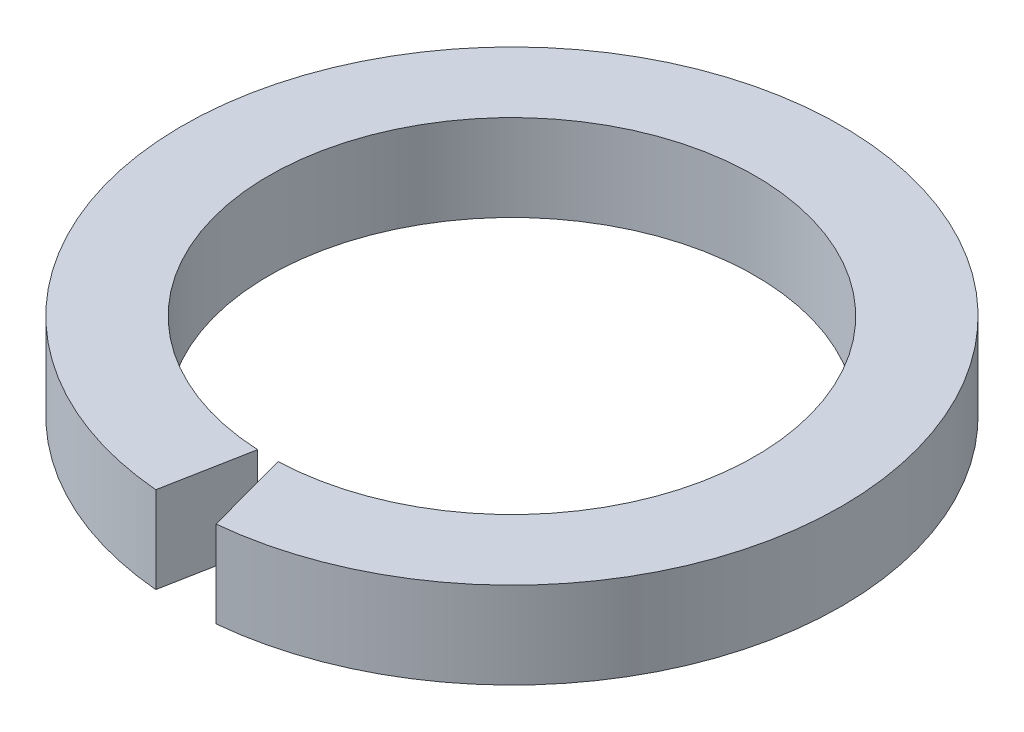
from build123d import *

# Parameters (mm, degrees)
SKETCH1_R               = 19.05
SKETCH1_R_2             = 14.05
BOSS_EXTRUDE1_DEPTH     = 5
CUT_EXTRUDE2_DEPTH      = 15
CUT_EXTRUDE2_DEPTH_BACK = 12


with BuildPart() as part:
    # Sketch1 → Boss-Extrude1 (new body)
    with BuildSketch(Plane(origin=(0, 0, 0), x_dir=(1, 0, 0), z_dir=(0, 1, 0))):
        Circle(SKETCH1_R)
        Circle(SKETCH1_R_2, mode=Mode.SUBTRACT)
    extrude(amount=BOSS_EXTRUDE1_DEPTH)

    # Sketch3 → Cut-Extrude2 (cut, two sides: drawn at the far end of the back side and taken through both)
    with BuildSketch(Plane(origin=(0, 0, 0), x_dir=(1, 0, 0), z_dir=(0, 1, 0)).offset(-CUT_EXTRUDE2_DEPTH_BACK)):
        Polygon((-1.8157354, -20.115587697), (2.167761571, -20.115587697), (0.310090919, -13.207691767), (0, -13.207691767), (-0.506048792, -13.207691767), align=None)
    extrude(amount=CUT_EXTRUDE2_DEPTH + CUT_EXTRUDE2_DEPTH_BACK, mode=Mode.SUBTRACT)


solid = part.part
